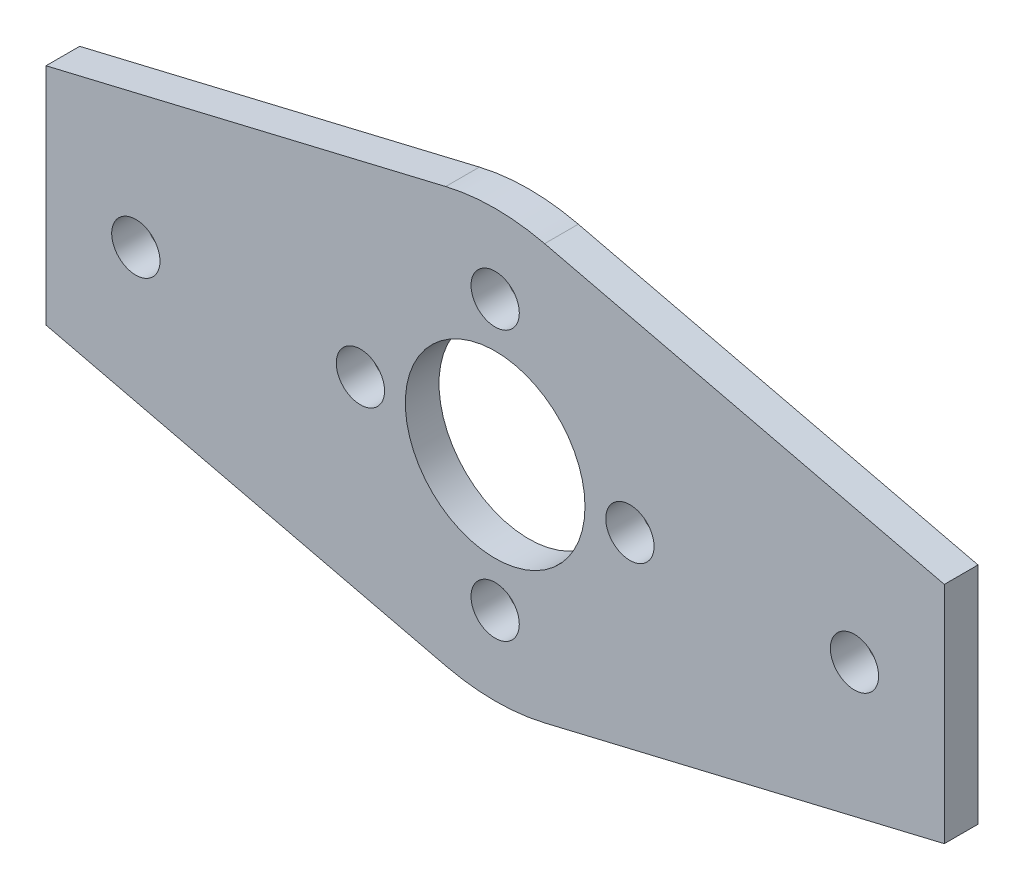
from build123d import *

# Parameters (mm, degrees)
SKETCH1_R      = 2.15
SKETCH1_R_2    = 8
EXTRUDE1_DEPTH = 3


with BuildPart() as part:
    # Sketch1 → Extrude1 (new body)
    with BuildSketch(Plane.XY):
        with BuildLine():
            Line((-29.77018823, -256.259354131), (-65.365803698, -264.741816005))
            Line((-65.365803698, -264.741816005), (-65.365803698, -284.741816005))
            Line((-65.365803698, -284.741816005), (-29.77018823, -293.224277878))
            ThreePointArc((-29.77018823, -293.224277878), (-25.365803698, -293.741816005), (-20.961419166, -293.224277878))
            Line((-20.961419166, -293.224277878), (14.634196302, -284.741816005))
            Line((14.634196302, -284.741816005), (14.634196302, -264.741816005))
            Line((14.634196302, -264.741816005), (-20.961419166, -256.259354131))
            ThreePointArc((-20.961419166, -256.259354131), (-25.365803698, -255.741816005), (-29.77018823, -256.259354131))
        make_face()
        with Locations((-57.365803698, -274.741816005)):
            Circle(SKETCH1_R, mode=Mode.SUBTRACT)
        with Locations((-37.365803698, -274.741816005)):
            Circle(SKETCH1_R, mode=Mode.SUBTRACT)
        with Locations((-25.365803698, -286.741816005)):
            Circle(SKETCH1_R, mode=Mode.SUBTRACT)
        with Locations((-25.365803698, -274.741816005)):
            Circle(SKETCH1_R_2, mode=Mode.SUBTRACT)
        with Locations((-13.365803698, -274.741816005)):
            Circle(SKETCH1_R, mode=Mode.SUBTRACT)
        with Locations((6.634196302, -274.741816005)):
            Circle(SKETCH1_R, mode=Mode.SUBTRACT)
        with Locations((-25.365803698, -262.741816005)):
            Circle(SKETCH1_R, mode=Mode.SUBTRACT)
    extrude(amount=EXTRUDE1_DEPTH)


solid = part.part
